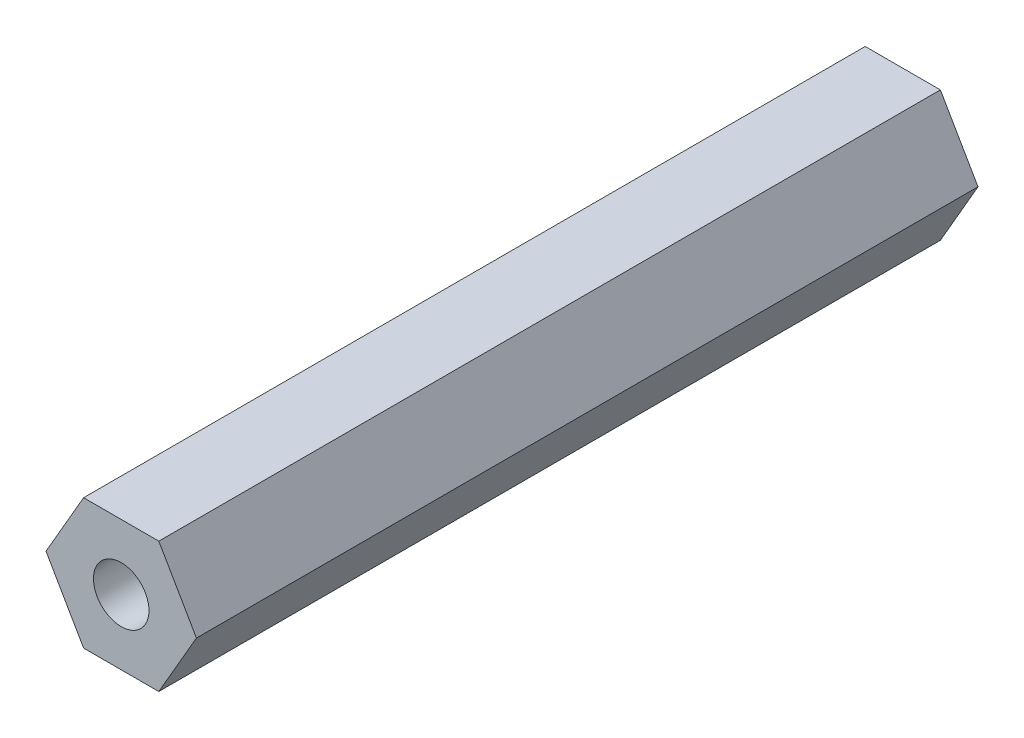
from build123d import *

# Parameters (mm, degrees)
BOSS_EXTRUDE1_DEPTH         = 38.1
F_1_4_28_TAPPED_HOLE1_D     = 5.4102
F_1_4_28_TAPPED_HOLE1_DEPTH = 22.225
F_1_4_28_TAPPED_HOLE1_TIP   = 1.625388061
F_1_4_28_TAPPED_HOLE2_D     = 5.4102
F_1_4_28_TAPPED_HOLE2_DEPTH = 22.225
F_1_4_28_TAPPED_HOLE2_TIP   = 1.625388061


with BuildPart() as part:
    # Sketch1 → Boss-Extrude1 (new, symmetric)
    with BuildSketch(Plane.XY):
        Polygon((7.332348419, 0), (3.666174209, 6.35), (-3.666174209, 6.35), (-7.332348419, 0), (-3.666174209, -6.35), (3.666174209, -6.35), align=None)
    extrude(amount=BOSS_EXTRUDE1_DEPTH, both=True)

    # 1/4-28 Tapped Hole1
    with Locations(Plane.XY.offset(38.1)):
        with Locations((0, 0)):
            Hole(F_1_4_28_TAPPED_HOLE1_D / 2, depth=F_1_4_28_TAPPED_HOLE1_DEPTH)
            with Locations((0, 0, -(F_1_4_28_TAPPED_HOLE1_DEPTH + F_1_4_28_TAPPED_HOLE1_TIP / 2))):  # 118° drill point
                Cone(0, F_1_4_28_TAPPED_HOLE1_D / 2, F_1_4_28_TAPPED_HOLE1_TIP, mode=Mode.SUBTRACT)

    # 1/4-28 Tapped Hole2
    with Locations(Plane(origin=(0, 0, -38.1), x_dir=(-1, 0, 0), z_dir=(0, 0, -1))):
        with Locations((0, 0)):
            Hole(F_1_4_28_TAPPED_HOLE2_D / 2, depth=F_1_4_28_TAPPED_HOLE2_DEPTH)
            with Locations((0, 0, -(F_1_4_28_TAPPED_HOLE2_DEPTH + F_1_4_28_TAPPED_HOLE2_TIP / 2))):  # 118° drill point
                Cone(0, F_1_4_28_TAPPED_HOLE2_D / 2, F_1_4_28_TAPPED_HOLE2_TIP, mode=Mode.SUBTRACT)


solid = part.part
